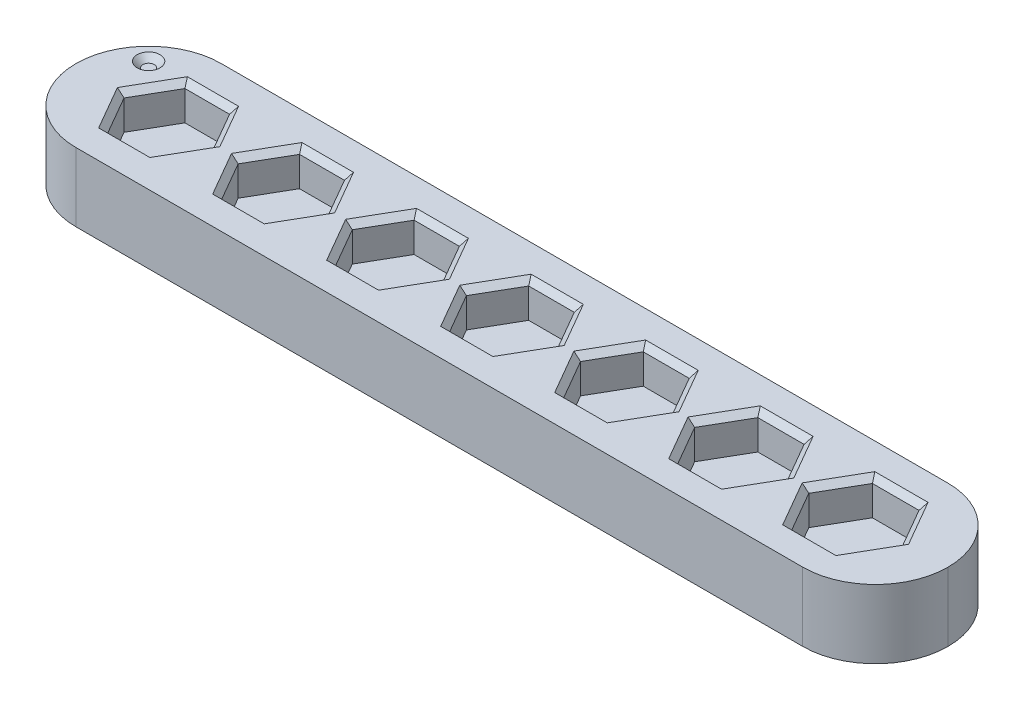
from build123d import *

# Parameters (mm, degrees)
SKETCH1_W           = 76.2
SKETCH1_H           = 12.7
BOSS_EXTRUDE1_DEPTH = 6
CUT_EXTRUDE1_DEPTH  = 3.1
LPATTERN1_START     = 2.9
LPATTERN1_DEPTH     = 3.1
SKETCH3_R           = 0.5
CUT_EXTRUDE2_DEPTH  = 0.5
FILLET1_R           = 6.35
CHAMFER1_SIZE       = 0.5


# Read off the part's stored shape, not the designer's step: LPattern1
with BuildPart() as part:
    # Sketch1 → Boss-Extrude1 (new body)
    with BuildSketch(Plane(origin=(0, 0, 0), x_dir=(1, 0, 0), z_dir=(0, 1, 0))):
        Rectangle(SKETCH1_W, SKETCH1_H)
    extrude(amount=BOSS_EXTRUDE1_DEPTH)

    # Sketch2 → Cut-Extrude1 (cut)
    with BuildSketch(Plane(origin=(0, 6, 0), x_dir=(1, 0, 0), z_dir=(0, 1, 0))):
        Polygon((1.991858429, 3.45), (-1.991858429, 3.45), (-3.983716857, 0), (-1.991858429, -3.45), (1.991858429, -3.45), (3.983716857, 0), align=None)
    extrude(amount=-CUT_EXTRUDE1_DEPTH, mode=Mode.SUBTRACT)

    # LPattern1 outline → LPattern1 (cut)
    with BuildSketch(Plane(origin=(0, 0, 0), x_dir=(1, 0, 0), z_dir=(0, 1, 0)).offset(LPATTERN1_START)):
        Polygon((-8.022575328, -3.425), (-6.045150656, 0), (-8.022575328, 3.425), (-11.977424672, 3.425), (-13.954849344, 0), (-11.977424672, -3.425), align=None)
        Polygon((-18.037009085, -3.4), (-16.07401817, 0), (-18.037009085, 3.4), (-21.962990915, 3.4), (-23.92598183, 0), (-21.962990915, -3.4), align=None)
        Polygon((-28.051442841, -3.375), (-26.102885683, 0), (-28.051442841, 3.375), (-31.948557159, 3.375), (-33.897114317, 0), (-31.948557159, -3.375), align=None)
        Polygon((12.006292185, -3.475), (14.012584371, 0), (12.006292185, 3.475), (7.993707815, 3.475), (5.987415629, 0), (7.993707815, -3.475), align=None)
        Polygon((22.020725942, -3.5), (24.041451884, 0), (22.020725942, 3.5), (17.979274058, 3.5), (15.958548116, 0), (17.979274058, -3.5), align=None)
        Polygon((32.035159699, -3.525), (34.070319398, 0), (32.035159699, 3.525), (27.964840301, 3.525), (25.929680602, 0), (27.964840301, -3.525), align=None)
    extrude(amount=LPATTERN1_DEPTH, mode=Mode.SUBTRACT)

    # Sketch3 → Cut-Extrude2 (cut)
    with BuildSketch(Plane(origin=(0, 6, 0), x_dir=(1, 0, 0), z_dir=(0, 1, 0))):
        with Locations(Location((-35.1, 3.35, 0), (0, 0, 270))):
            Circle(SKETCH3_R)
    extrude(amount=-CUT_EXTRUDE2_DEPTH, mode=Mode.SUBTRACT)

    # Fillet1
    fillet1_edges = [part.edges().sort_by_distance(p)[0] for p in [
        (38.1, 3, -6.35),
        (38.1, 3, 6.35),
        (-38.1, 3, -6.35),
        (-38.1, 3, 6.35),
    ]]
    fillet(fillet1_edges, radius=FILLET1_R - 0.0001)  # a hair under: the kernel refuses the full size

    # Chamfer1
    chamfer1_edges = [part.edges().sort_by_distance(p)[0] for p in [
        (-35.1, 6, -3.85),
        (2.987787643, 6, -1.725),
        (0, 6, -3.45),
        (-2.987787643, 6, -1.725),
        (-2.987787643, 6, 1.725),
        (0, 6, 3.45),
        (2.987787643, 6, 1.725),
        (33.052739548, 6, -1.7625),
        (30, 6, -3.525),
        (26.947260452, 6, -1.7625),
        (26.947260452, 6, 1.7625),
        (30, 6, 3.525),
        (33.052739548, 6, 1.7625),
        (23.031088913, 6, -1.75),
        (20, 6, -3.5),
        (16.968911087, 6, -1.75),
        (16.968911087, 6, 1.75),
        (20, 6, 3.5),
        (23.031088913, 6, 1.75),
        (13.009438278, 6, -1.7375),
        (10, 6, -3.475),
        (6.990561722, 6, -1.7375),
        (6.990561722, 6, 1.7375),
        (10, 6, 3.475),
        (13.009438278, 6, 1.7375),
        (-27.077164262, 6, -1.6875),
        (-30, 6, -3.375),
        (-32.922835738, 6, -1.6875),
        (-32.922835738, 6, 1.6875),
        (-30, 6, 3.375),
        (-27.077164262, 6, 1.6875),
        (-17.055513628, 6, -1.7),
        (-20, 6, -3.4),
        (-22.944486373, 6, -1.7),
        (-22.944486372, 6, 1.7),
        (-20, 6, 3.4),
        (-17.055513627, 6, 1.7),
        (-7.033862992, 6, -1.7125),
        (-10, 6, -3.425),
        (-12.966137008, 6, -1.7125),
        (-12.966137008, 6, 1.7125),
        (-10, 6, 3.425),
        (-7.033862992, 6, 1.7125),
    ]]
    chamfer(chamfer1_edges, length=CHAMFER1_SIZE - 0.0001)  # a hair under: the kernel refuses the full size


solid = part.part
